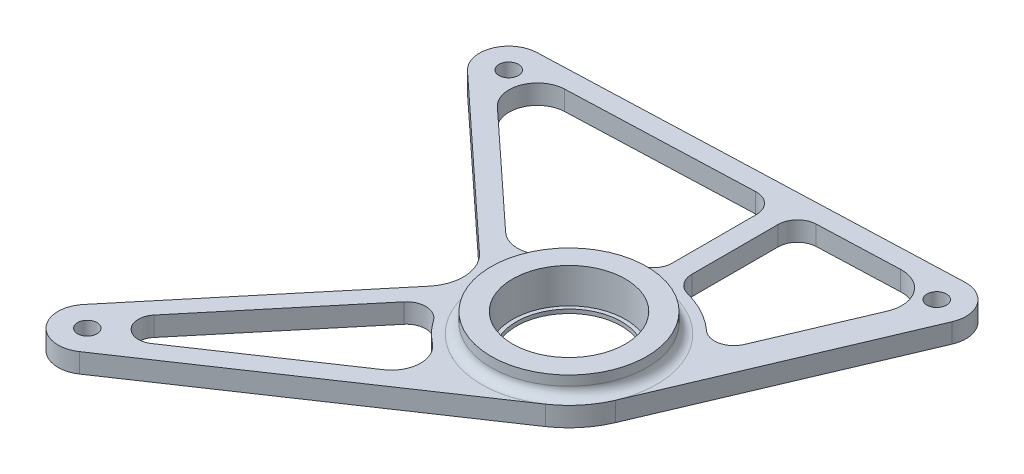
from build123d import *

# Parameters (mm, degrees)
DODANIE_WYCI_GNI_CIE1_DEPTH = 10
OTW_R1_D                    = 58
OTW_R1_DEPTH                = 8
OTW_R2_D                    = 54
OTW_R2_DEPTH                = 10
SZKIC8_R                    = 40
SZKIC8_R_2                  = 29
DODANIE_WYCI_GNI_CIE2_DEPTH = 10
OTW_R3_D                    = 10
OTW_R3_DEPTH                = 100
OTW_R4_D                    = 10
OTW_R4_DEPTH                = 100
OTW_R6_D                    = 10
ZAOKR_GLENIE7_R             = 5
WYTNIJ_WYCI_GNI_CIE1_DEPTH  = 1970.877508784
ZAOKR_GLENIE8_R             = 10
ZAOKR_GLENIE9_R             = 15
ZAOKR_GLENIE10_R            = 20


with BuildPart() as part:
    # Szkic1 → Dodanie-wyciągnięcie1 (new body)
    with BuildSketch(Plane(origin=(0, 0, 0), x_dir=(1, 0, 0), z_dir=(0, 1, 0))):
        with BuildLine():
            Line((-1703.3488692, -133.220934409), (-1915.5488692, -140.99080739))
            ThreePointArc((-1915.5488692, -140.99080739), (-1929.062408554, -150.760736666), (-1925.196856926, -166.981857914))
            Line((-1925.196856926, -166.981857914), (-1827, -258))
            Line((-1827, -258), (-1919.883316335, -369.636330483))
            ThreePointArc((-1919.883316335, -369.636330483), (-1919.48315677, -389.285445814), (-1899.97553639, -391.673040436))
            Line((-1899.97553639, -391.673040436), (-1756.869002877, -295.328715269))
            ThreePointArc((-1756.869002877, -295.328715269), (-1747.290078221, -286.639506457), (-1740.578075644, -275.584771329))
            Line((-1740.578075644, -275.584771329), (-1688.992691881, -154.072479575))
            ThreePointArc((-1688.992691881, -154.072479575), (-1690.445110903, -139.704614072), (-1703.3488692, -133.220934409))
        make_face()
    extrude(amount=DODANIE_WYCI_GNI_CIE1_DEPTH)

    # Otwór1
    with Locations(Plane(origin=(0, 10, 0), x_dir=(1, 0, 0), z_dir=(0, 1, 0))):
        with Locations((-1782, -258)):
            Hole(OTW_R1_D / 2, depth=OTW_R1_DEPTH)

    # Otwór2
    with Locations(Plane(origin=(0, 2, 0), x_dir=(1, 0, 0), z_dir=(0, 1, 0))):
        with Locations((-1782, -258)):
            Hole(OTW_R2_D / 2, depth=OTW_R2_DEPTH)

    # Szkic8 → Dodanie-wyciągnięcie2 (add)
    with BuildSketch(Plane(origin=(0, 10, 0), x_dir=(1, 0, 0), z_dir=(0, 1, 0))):
        with Locations(Location((-1782, -258, 0), (0, 0, 270))):
            Circle(SZKIC8_R)
        with Locations(Location((-1782, -258, 0), (0, 0, 270))):
            Circle(SZKIC8_R_2, mode=Mode.SUBTRACT)
    extrude(amount=DODANIE_WYCI_GNI_CIE2_DEPTH)

    # Otwór3
    with Locations(Plane(origin=(0, 10, 0), x_dir=(1, 0, 0), z_dir=(0, 1, 0))):
        with Locations((-1702.8, -148.210889132)):
            Hole(OTW_R3_D / 2, depth=OTW_R3_DEPTH)

    # Otwór4
    with Locations(Plane(origin=(0, 10, 0), x_dir=(1, 0, 0), z_dir=(0, 1, 0))):
        with Locations((-1915, -155.980762114)):
            Hole(OTW_R4_D / 2, depth=OTW_R4_DEPTH)

    # Otwór6 (through all)
    with Locations(Plane(origin=(0, 10, 0), x_dir=(1, 0, 0), z_dir=(0, 1, 0))):
        with Locations((-1908.352535431, -379.230135346)):
            Hole(OTW_R6_D / 2)

    # Zaokrąglenie7
    zaokr_glenie7_edges = [part.edges().sort_by_distance(p)[0] for p in [
        (-1782, 10, 218),
    ]]
    fillet(zaokr_glenie7_edges, radius=ZAOKR_GLENIE7_R - 0.0001)  # a hair under: the kernel refuses the full size

    # Szkic19 → Wytnij-wyciągnięcie1 (cut, through all)
    with BuildSketch(Plane(origin=(0, 10, 0), x_dir=(1, 0, 0), z_dir=(0, 1, 0))):
        with BuildLine():
            Line((-1892.095122082, -150.138730991), (-1787, -146.290588911))
            Line((-1787, -146.290588911), (-1787, -208.250628145))
            ThreePointArc((-1787, -208.250628145), (-1813.204404989, -218.932300947), (-1829.413802222, -242.127654275))
            Line((-1829.413802222, -242.127654275), (-1901.454839944, -175.353201277))
            ThreePointArc((-1901.454839944, -175.353201277), (-1905.2048937, -159.616746941), (-1892.095122082, -150.138730991))
        make_face()
        with BuildLine():
            Line((-1792.073707618, -306.974691575), (-1885.096997852, -369.601225125))
            ThreePointArc((-1885.096997852, -369.601225125), (-1896.876470061, -368.159501125), (-1897.118102223, -356.294588671))
            Line((-1897.118102223, -356.294588671), (-1838.74984943, -286.141865711))
            ThreePointArc((-1838.74984943, -286.141865711), (-1830.659832163, -282.545852514), (-1822.885551801, -286.781446349))
            ThreePointArc((-1822.885551801, -286.781446349), (-1809.407176402, -299.819214264), (-1792.073707618, -306.974691575))
        make_face()
        with BuildLine():
            Line((-1710.364646313, -166.029841764), (-1738.754475915, -232.90369257))
            ThreePointArc((-1738.754475915, -232.90369257), (-1754.910314787, -215.974424988), (-1777, -208.250628145))
            Line((-1777, -208.250628145), (-1777, -145.9244309))
            Line((-1777, -145.9244309), (-1725.50528476, -144.038910652))
            ThreePointArc((-1725.50528476, -144.038910652), (-1711.896429516, -150.876876456), (-1710.364646313, -166.029841764))
        make_face()
    extrude(amount=-WYTNIJ_WYCI_GNI_CIE1_DEPTH, mode=Mode.SUBTRACT)

    # Zaokrąglenie8
    zaokr_glenie8_edges = [part.edges().sort_by_distance(p)[0] for p in [
        (-1787, 5, 208.250628145),
        (-1787, 5, 146.290588911),
        (-1738.754475915, 5, 232.90369257),
        (-1777, 5, 208.250628145),
        (-1777, 5, 145.9244309),
    ]]
    fillet(zaokr_glenie8_edges, radius=ZAOKR_GLENIE8_R)

    # Zaokrąglenie9
    zaokr_glenie9_edges = [part.edges().sort_by_distance(p)[0] for p in [
        (-1829.413802222, 5, 242.127654275),
        (-1792.073707618, 5, 306.974691575),
    ]]
    fillet(zaokr_glenie9_edges, radius=ZAOKR_GLENIE9_R)

    # Zaokrąglenie10
    zaokr_glenie10_edges = [part.edges().sort_by_distance(p)[0] for p in [
        (-1827, 5, 258),
    ]]
    fillet(zaokr_glenie10_edges, radius=ZAOKR_GLENIE10_R)


solid = part.part
